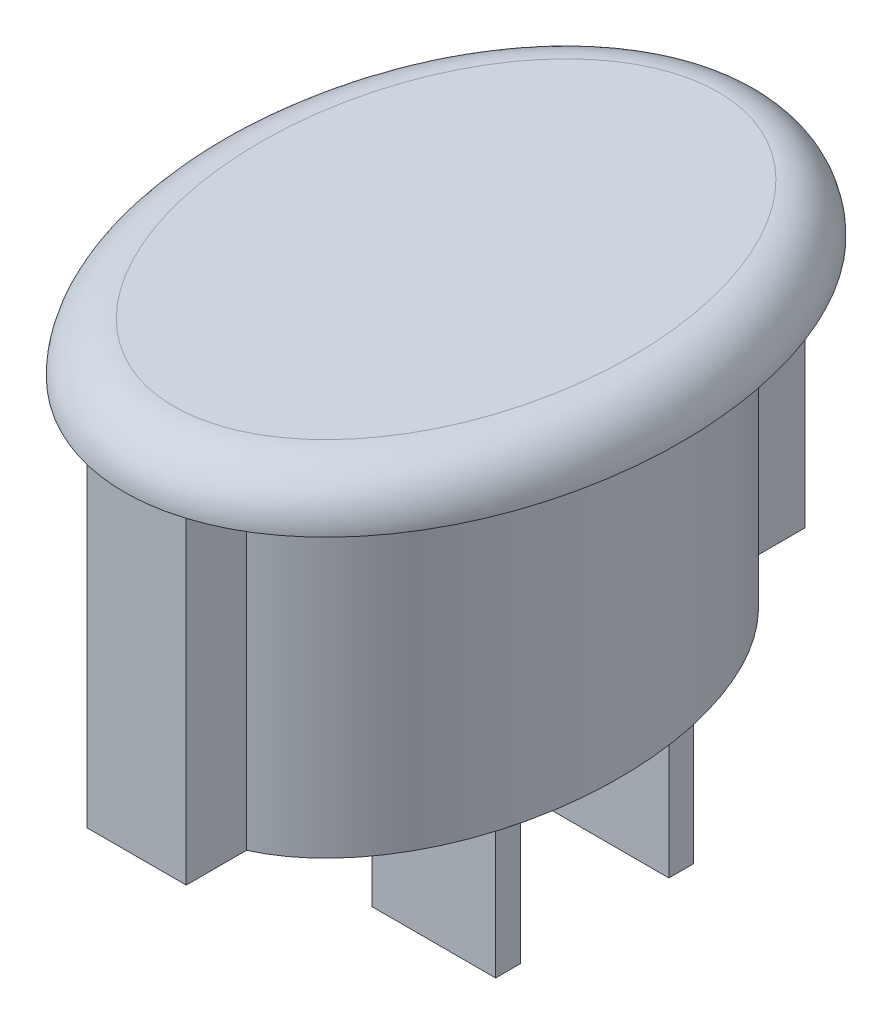
from build123d import *

# Parameters (mm, degrees)
BOSS_EXTRU_1_DEPTH = 13
BOSS_EXTRU_2_DEPTH = 2
CONG_1_R           = 2
ESQUISSE3_W        = 5
ESQUISSE3_H        = 1
BOSS_EXTRU_3_DEPTH = 9


# Read off the part's stored shape, not the designer's step: Boss.-Extru.2
with BuildPart() as part:
    # Esquisse1 → Boss.-Extru.1 (new body)
    with BuildSketch(Plane(origin=(0, 0, 0), x_dir=(1, 0, 0), z_dir=(0, 1, 0))):
        with BuildLine():
            Line((2, 10.062305899), (2, 12.5))
            Line((2, 12.5), (-2, 12.5))
            Line((-2, 12.5), (-2, 10.062305899))
            add(Edge.make_bspline(
                [(-2, 10.062305899), (-24.5, 0), (-2, -10.062305899)],
                knots=[3.431344355, 3.431344355, 3.431344355, 5.993433606, 5.993433606, 5.993433606], degree=2, weights=[1, 0.285714286, 1]))
            Line((-2, -10.062305899), (-2, -12.5))
            Line((-2, -12.5), (2, -12.5))
            Line((2, -12.5), (2, -10.062305899))
            add(Edge.make_bspline(
                [(2, -10.062305899), (24.5, 0), (2, 10.062305899)],
                knots=[0.289751701, 0.289751701, 0.289751701, 2.851840952, 2.851840952, 2.851840952], degree=2, weights=[1, 0.285714286, 1]))
        make_face()
    extrude(amount=BOSS_EXTRU_1_DEPTH)

    # Boss.-Extru.2 outline → Boss.-Extru.2 (add)
    with BuildSketch(Plane(origin=(0, 13, 0), x_dir=(1, 0, 0), z_dir=(0, 1, 0))):
        with BuildLine():
            add(Edge.make_bspline(
                [(0, -13), (0.703240737, -13), (2.109722211, -12.789689498), (4.688231544, -11.602625859), (7.229672734, -8.991447827), (9.080604982, -4.777577384), (9.709697509, 0), (9.080604982, 4.777577384), (7.229672734, 8.991447827), (4.688231544, 11.602625859), (2.109722211, 12.789689498), (0, 13.105155251), (-2.109722211, 12.789689498), (-4.688231544, 11.602625859), (-7.229672734, 8.991447827), (-9.080604982, 4.777577384), (-9.709697509, 0), (-9.080604982, -4.777577384), (-7.229672734, -8.991447827), (-4.688231544, -11.602625859), (-2.109722211, -12.789689498), (-0.703240737, -13), (0, -13)],
                knots=[0, 0, 0, 0, 0.196349541, 0.392699082, 0.785398163, 1.178097245, 1.570796327, 1.963495408, 2.35619449, 2.748893572, 2.945243113, 3.141592654, 3.337942194, 3.534291735, 3.926990817, 4.319689899, 4.71238898, 5.105088062, 5.497787144, 5.890486225, 6.086835766, 6.283185307, 6.283185307, 6.283185307, 6.283185307], degree=3))
        make_face()
    extrude(amount=BOSS_EXTRU_2_DEPTH)

    # Congé1
    cong_1_edges = [part.edges().sort_by_distance(p)[0] for p in [
        (0, 15, -13),
    ]]
    fillet(cong_1_edges, radius=CONG_1_R - 0.0004)  # a hair under: the kernel refuses the full size

    # Esquisse3 → Boss.-Extru.3 (add)
    with BuildSketch(Plane.XZ):
        Rectangle(ESQUISSE3_W, ESQUISSE3_H)
        with Locations((0, -7)):
            Rectangle(ESQUISSE3_W, ESQUISSE3_H)
    extrude(amount=BOSS_EXTRU_3_DEPTH)


solid = part.part
